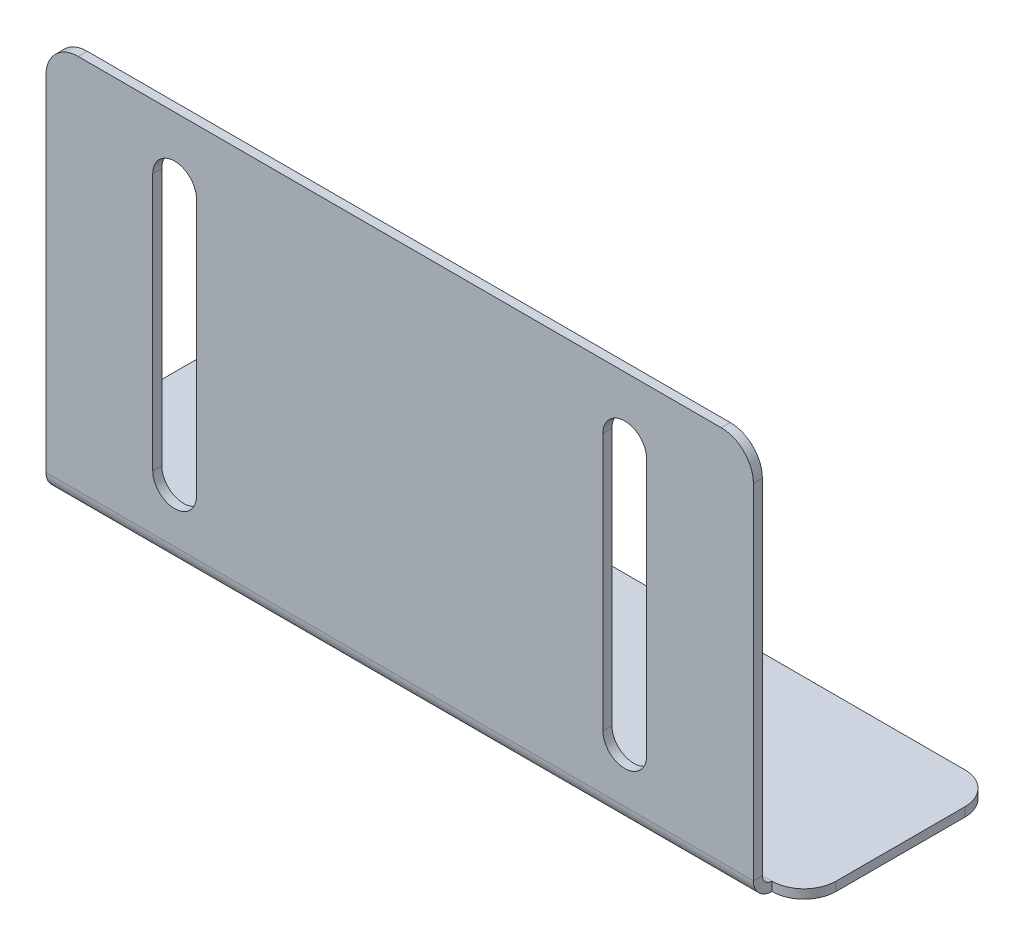
from build123d import *

# Parameters (mm, degrees)
SKETCH1_W             = 60
SKETCH1_H             = 15
BASE_FLANGE1_DEPTH    = 0.7
EDGE_FLANGE1_DEPTH    = 55
CUT_EXTRUDE1_DEPTH    = 46.250862749
BREAK_CORNER1_START   = -0.7
BREAK_CORNER1_DEPTH   = 0.7
BREAK_CORNER1_START_2 = 8.2366
BREAK_CORNER1_2_DEPTH = 0.7


# Read off the part's stored shape, not the designer's step: Break-Corner1
# Sheet-metal steps are written as plain solids
with BuildPart() as part:
    # Sketch1 → Base-Flange1 (new body)
    with BuildSketch(Plane(origin=(0, 0, 0), x_dir=(1, 0, 0), z_dir=(0, 1, 0))):
        Rectangle(SKETCH1_W, SKETCH1_H)
    extrude(amount=-BASE_FLANGE1_DEPTH)

    # Edge-Flange1 section (across the edge) → Edge-Flange1 (add)
    with BuildSketch(Plane(origin=(-27.5, 0, 8.2366), x_dir=(0, 0, -1), z_dir=(1, 0, 0))):
        with BuildLine():
            Line((-0.7, 0.7366), (-0.7, 30))
            Line((-0.7, 30), (0, 30))
            Line((0, 30), (0, 0.7366))
            ThreePointArc((0, 0.7366), (0.215745145, 0.215745145), (0.7366, 0))
            Line((0.7366, 0), (0.7366, -0.7))
            ThreePointArc((0.7366, -0.7), (-0.279229602, -0.279229602), (-0.7, 0.7366))
        make_face()
    extrude(amount=EDGE_FLANGE1_DEPTH)

    # Sketch7 → Cut-Extrude1 (cut, through all)
    with BuildSketch(Plane(origin=(0, 0, 8.2366), x_dir=(-1, 0, 0), z_dir=(0, 0, -1))):
        with BuildLine():
            Line((-15.8, 25), (-15.8, 5))
            ThreePointArc((-15.8, 5), (-17.5, 3.3), (-19.2, 5))
            Line((-19.2, 5), (-19.2, 25))
            ThreePointArc((-19.2, 25), (-17.5, 26.7), (-15.8, 25))
        make_face()
        with BuildLine():
            Line((19.2, 25), (19.2, 5))
            ThreePointArc((19.2, 5), (17.5, 3.3), (15.8, 5))
            Line((15.8, 5), (15.8, 25))
            ThreePointArc((15.8, 25), (17.5, 26.7), (19.2, 25))
        make_face()
    extrude(amount=-CUT_EXTRUDE1_DEPTH, mode=Mode.SUBTRACT)

    # Break-Corner1 outline → Break-Corner1 (cut)
    with BuildSketch(Plane(origin=(0, 0, 0), x_dir=(1, 0, 0), z_dir=(0, 1, 0)).offset(BREAK_CORNER1_START)):
        with BuildLine():
            ThreePointArc((-27.501, -7.5), (-29.268059846, -6.768059846), (-30, -5.001))
            Line((-30, -5.001), (-30, -7.5))
            Line((-30, -7.5), (-27.501, -7.5))
        make_face()
        with BuildLine():
            ThreePointArc((-30, 5.001), (-29.268059846, 6.768059846), (-27.501, 7.5))
            Line((-27.501, 7.5), (-30, 7.5))
            Line((-30, 7.5), (-30, 5.001))
        make_face()
        with BuildLine():
            ThreePointArc((27.501, 7.5), (29.268059846, 6.768059846), (30, 5.001))
            Line((30, 5.001), (30, 7.5))
            Line((30, 7.5), (27.501, 7.5))
        make_face()
        with BuildLine():
            ThreePointArc((30, -5.001), (29.268059846, -6.768059846), (27.501, -7.5))
            Line((27.501, -7.5), (30, -7.5))
            Line((30, -7.5), (30, -5.001))
        make_face()
    extrude(amount=BREAK_CORNER1_DEPTH, mode=Mode.SUBTRACT)

    # Break-Corner1 2 outline → Break-Corner1 2 (cut)
    with BuildSketch(Plane.XY.offset(BREAK_CORNER1_START_2)):
        with BuildLine():
            Line((-27.5, 30), (-27.5, 27.501))
            ThreePointArc((-27.5, 27.501), (-26.768059846, 29.268059846), (-25.001, 30))
            Line((-25.001, 30), (-27.5, 30))
        make_face()
        with BuildLine():
            Line((27.5, 30), (25.001, 30))
            ThreePointArc((25.001, 30), (26.768059846, 29.268059846), (27.5, 27.501))
            Line((27.5, 27.501), (27.5, 30))
        make_face()
    extrude(amount=BREAK_CORNER1_2_DEPTH, mode=Mode.SUBTRACT)


solid = part.part
